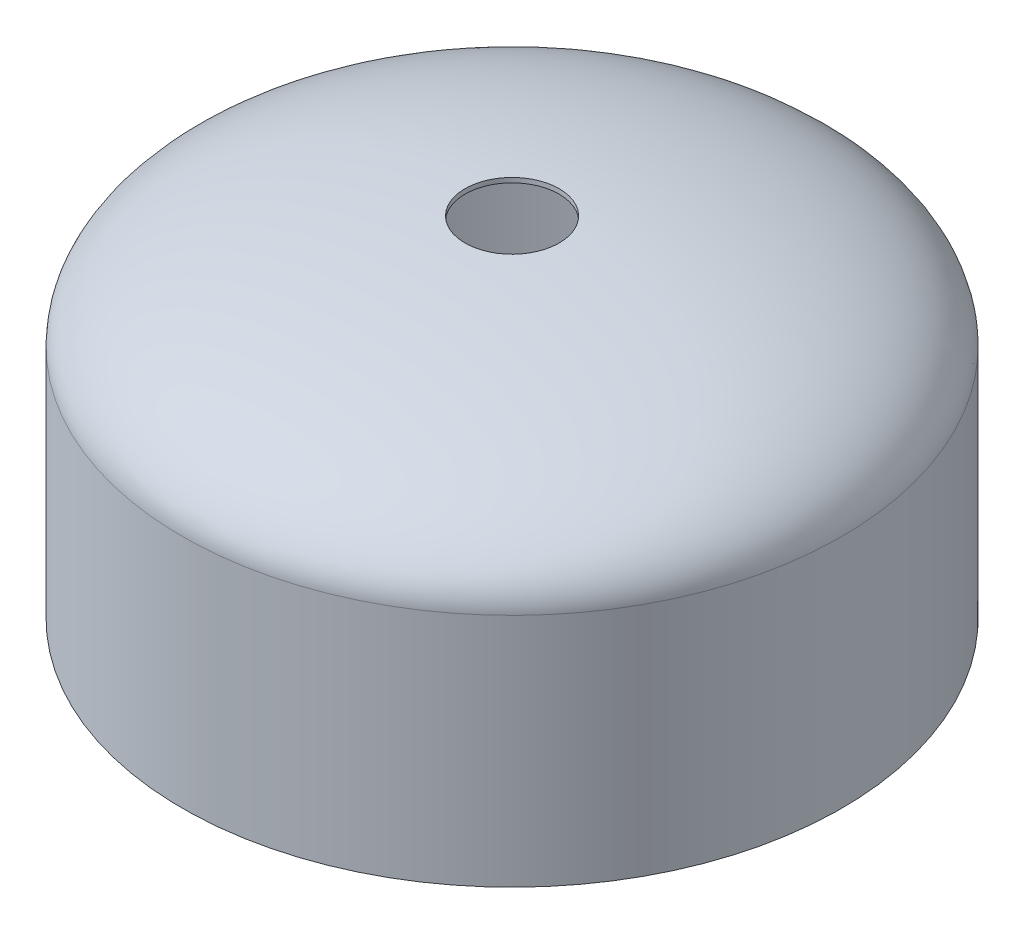
from build123d import *


with BuildPart() as part:
    # Sketch1 → Revolve1 (revolve)
    with BuildSketch(Plane.XY):
        with BuildLine():
            Line((175.26, -127), (175.26, 0))
            add(Edge.make_bspline(
                [(175.26, 0), (175.26, 51.025063291), (25.4, 58.42)],
                knots=[0, 0, 0, 1.425356592, 1.425356592, 1.425356592], degree=2, weights=[1, 0.756613354, 1]))
            Line((25.4, 58.42), (25.4, 60.96))
            add(Edge.make_bspline(
                [(177.8, 0), (177.8, 53.34), (25.4, 60.96)],
                knots=[0, 0, 0, 1.427448758, 1.427448758, 1.427448758], degree=2, weights=[1, 0.755928946, 1]))
            Line((177.8, 0), (177.8, -127))
            Line((177.8, -127), (175.26, -127))
        make_face()
    revolve(axis=Axis((0, -109.728, 0), (0, 1, 0)))


solid = part.part
